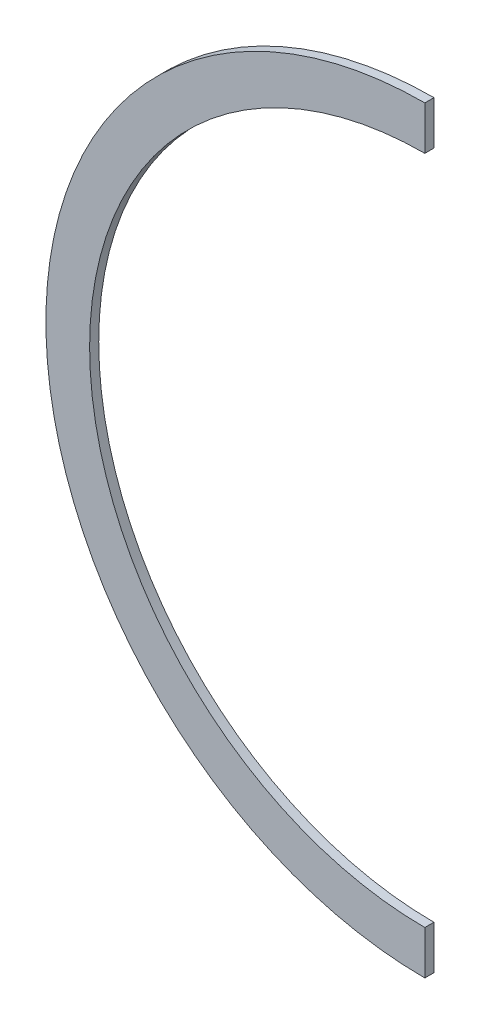
from build123d import *

# Parameters (mm, degrees)
SKETCH2_R           = 116.84
BOSS_EXTRUDE1_DEPTH = 1.5875
SKETCH3_W           = 232.210592103
SKETCH3_H           = 398.954583541
CUT_EXTRUDE1_DEPTH  = 190.3271535


with BuildPart() as part:
    # Sketch2 → Boss-Extrude1 (new, symmetric)
    with BuildSketch(Plane.XY):
        with BuildLine():
            ThreePointArc((-1.651, 128.513680847), (-113.44208216, 64.09028885), (-116.977106193, -64.886930424))
            ThreePointArc((-116.977106193, -64.886930424), (-116.59127356, -65.61727077), (-116.200881143, -66.345183954))
            ThreePointArc((-116.200881143, -66.345183954), (-115.806084025, -67.070386581), (-115.406761019, -67.793106963))
            ThreePointArc((-115.406761019, -67.793106963), (0, -135.636), (115.406761019, -67.793106963))
            ThreePointArc((115.406761019, -67.793106963), (115.804512811, -67.073251299), (116.197774523, -66.350932884))
            ThreePointArc((116.197774523, -66.350932884), (116.589738292, -65.620154913), (116.977106193, -64.886930424))
            ThreePointArc((116.977106193, -64.886930424), (113.44208216, 64.09028885), (1.651, 128.513680847))
            ThreePointArc((1.651, 128.513680847), (0.825516124, 128.521420187), (0, 128.524))
            ThreePointArc((0, 128.524), (-0.825516124, 128.521420187), (-1.651, 128.513680847))
        make_face()
        with Locations((0, -3.556)):
            Circle(SKETCH2_R, mode=Mode.SUBTRACT)
    extrude(amount=BOSS_EXTRUDE1_DEPTH, both=True)

    # Sketch3 → Cut-Extrude1 (cut, through all)
    with BuildSketch(Plane(origin=(0, 0, 0), x_dir=(0, 0, -1), z_dir=(1, 0, 0))):
        with Locations((6.714523145, -6.913261573)):
            Rectangle(SKETCH3_W, SKETCH3_H)
    extrude(amount=CUT_EXTRUDE1_DEPTH, mode=Mode.SUBTRACT)


solid = part.part
